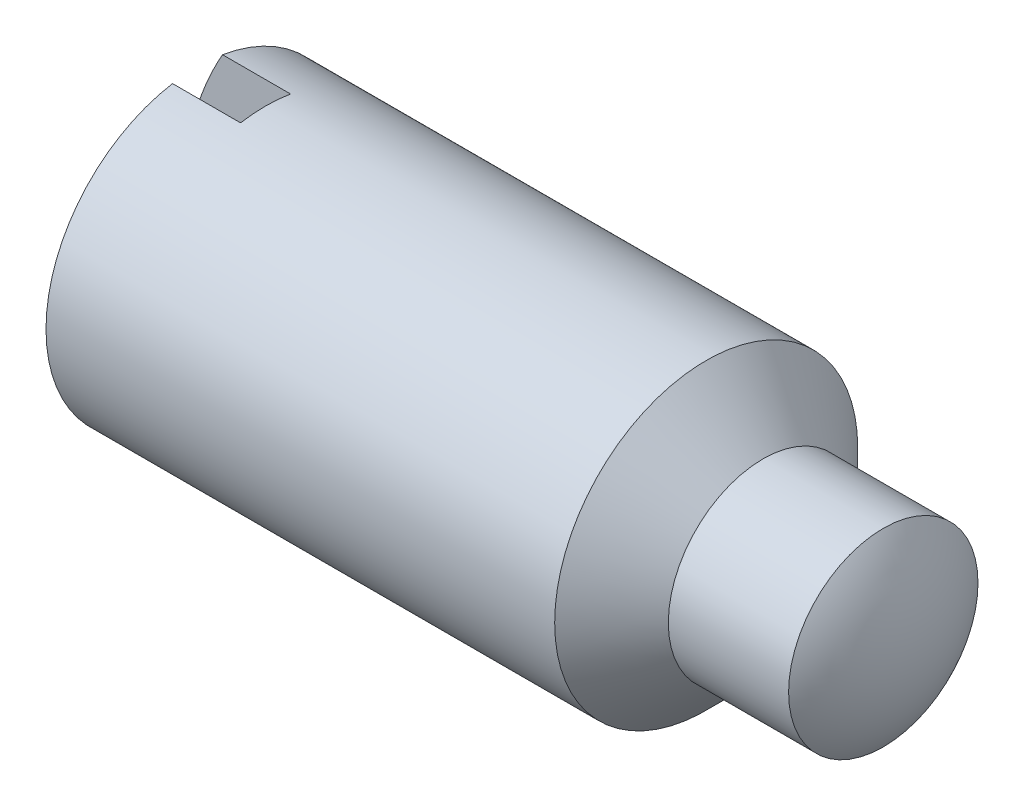
from build123d import *

# Parameters (mm, degrees)
SLOT_DEPTH      = 11.392304845413264
SLOT_DEPTH_BACK = 11.392304845413264


with BuildPart() as part:
    # Sketch1 → Base (revolve)
    with BuildSketch(Plane(origin=(11.146889757295497, 0, 2.0000000000000386), x_dir=(1, 0, 0), z_dir=(0, 1, 0))):
        with BuildLine():
            Line((-1.146889757295497, 2.0000000000000386), (-11.146889757295497, 2.0000000000000386))
            ThreePointArc((-11.146889757295497, 2.0000000000000386), (-11.010593062451768, 3.035276180410121), (-10.61099137243325, 4.000000000000037))
            Line((-10.61099137243325, 4.000000000000037), (-3.896889757295494, 4.000000000000038))
            Line((-3.896889757295494, 4.000000000000038), (-3.1468897572954972, 3.2500000000000386))
            Line((-3.1468897572954972, 3.2500000000000386), (-1.5594360542268766, 3.2500000000000386))
            ThreePointArc((-1.5594360542268766, 3.2500000000000386), (-1.2526915755136432, 2.6581592601931536), (-1.146889757295497, 2.0000000000000386))
        make_face()
    revolve(axis=Axis((-4.179393059278773, 0, 0), (1, 0, 0)))

    # Sketch2 → Slot (cut, two sides: drawn at the far end of the back side and taken through both)
    with BuildSketch(Plane(origin=(0, 0, 0), x_dir=(1, 0, 0), z_dir=(0, 1, 0)).offset(-SLOT_DEPTH_BACK)):
        with BuildLine():
            Line((1.4336357416813998, 0.33000000000000046), (0.01363574168140001, 0.33000000000000046))
            ThreePointArc((0.01363574168140001, 0.33000000000000046), (-0.31636425831859993, 5.3e-16), (0.01363574168140001, -0.3299999999999995))
            Line((0.01363574168140001, -0.3299999999999995), (1.4336357416813998, -0.3299999999999995))
            Line((1.4336357416813998, -0.3299999999999995), (1.4336357416813998, 0.33000000000000046))
        make_face()
    extrude(amount=SLOT_DEPTH + SLOT_DEPTH_BACK, mode=Mode.SUBTRACT)


solid = part.part
